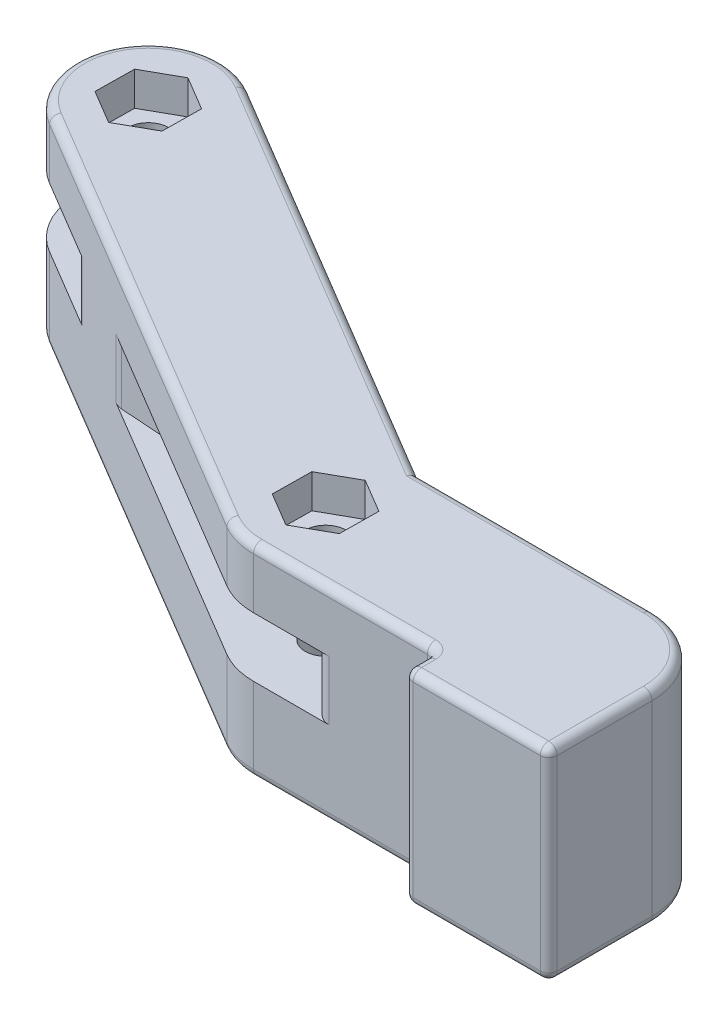
from build123d import *

# Parameters (mm, degrees)
SKETCH1_R               = 1.2
BOSS_EXTRUDE1_DEPTH     = 12
CUT_EXTRUDE1_DEPTH      = 2.5
CUT_EXTRUDE1_DEPTH_BACK = 1
CUT_EXTRUDE2_DEPTH      = 2
SKETCH5_R               = 2.05
CUT_EXTRUDE3_DEPTH      = 2
FILLET1_R               = 1
FILLET2_R               = 0.5


with BuildPart() as part:
    # Sketch1 → Boss-Extrude1 (new body)
    with BuildSketch(Plane(origin=(0, 0, 0), x_dir=(1, 0, 0), z_dir=(0, 1, 0))):
        with BuildLine():
            Line((1.323018794, 17.222814504), (26.105840038, 2.488576956))
            Line((26.105840038, 2.488576956), (39.937870576, 2.488576956))
            ThreePointArc((39.937870576, 2.488576956), (42.943074396, 1.243780776), (44.187870576, -1.761423044))
            Line((44.187870576, -1.761423044), (44.187870576, -7.85))
            Line((44.187870576, -7.85), (35.687870576, -7.85))
            Line((35.687870576, -7.85), (35.687870576, -6.011423044))
            Line((35.687870576, -6.011423044), (24.937870576, -6.011423044))
            ThreePointArc((24.937870576, -6.011423044), (23.811655258, -5.859488326), (22.76596286, -5.414547306))
            Line((22.76596286, -5.414547306), (-3.020796638, 9.91656598))
            ThreePointArc((-3.020796638, 9.91656598), (-4.502013184, 15.741597958), (1.323018794, 17.222814504))
        make_face()
        with Locations(Location((-0.848888922, 13.569690242, 0), (0, 0, 270))):
            Circle(SKETCH1_R, mode=Mode.SUBTRACT)
        with Locations(Location((24.937870576, -1.761423044, 0), (0, 0, 270))):
            Circle(SKETCH1_R, mode=Mode.SUBTRACT)
    extrude(amount=BOSS_EXTRUDE1_DEPTH)

    # Sketch3 → Cut-Extrude1 (cut, two sides: drawn at the far end of the back side and taken through both)
    with BuildSketch(Plane(origin=(0, 6, 0), x_dir=(1, 0, 0), z_dir=(0, 1, 0)).offset(-CUT_EXTRUDE1_DEPTH_BACK)):
        with BuildLine():
            Line((-22.892544244, 0.947199994), (-3.741433166, 17.016890236))
            ThreePointArc((-3.741433166, 17.016890236), (2.065644543, 16.998318931), (3.019125003, 11.270023249))
            Line((3.019125003, 11.270023249), (-1.084785494, 4.367292117))
            ThreePointArc((-1.084785494, 4.367292117), (-0.38864398, 4.483185905), (0.317056148, 4.488816704))
            Line((0.317056148, 4.488816704), (25.254926724, 2.72739366))
            ThreePointArc((25.254926724, 2.72739366), (28.925298394, 0.324342858), (28.805884501, -4.061090037))
            Line((28.805884501, -4.061090037), (16.029956762, -25.550056285))
            ThreePointArc((16.029956762, -25.550056285), (9.862275844, -27.118403217), (8.293928913, -20.950722299))
            Line((8.293928913, -20.950722299), (17.339631919, -5.735951945))
            Line((17.339631919, -5.735951945), (-0.317056148, -4.488816704))
            ThreePointArc((-0.317056148, -4.488816704), (-2.876129239, -3.460907482), (-4.354991754, -1.1331579))
            Line((-4.354991754, -1.1331579), (-9.756802736, -10.218942999))
            ThreePointArc((-9.756802736, -10.218942999), (-15.508332614, -12.006129032), (-17.885892009, -6.472473713))
            ThreePointArc((-17.885892009, -6.472473713), (-23.730198417, -5.017065706), (-22.892544244, 0.947199994))
        make_face()
    extrude(amount=CUT_EXTRUDE1_DEPTH + CUT_EXTRUDE1_DEPTH_BACK, mode=Mode.SUBTRACT)

    # Sketch4 → Cut-Extrude2 (cut)
    with BuildSketch(Plane(origin=(0, 12, 0), x_dir=(1, 0, 0), z_dir=(0, 1, 0))):
        Polygon((22.952804904, -0.581233393), (22.923263521, -2.890445518), (24.908329193, -4.07063517), (26.922936248, -2.941612695), (26.952477631, -0.63240057), (24.967411959, 0.547789081), align=None)
        Polygon((1.13617675, 12.389500591), (1.165718133, 14.698712717), (-0.819347539, 15.878902368), (-2.833954594, 14.749879893), (-2.863495977, 12.440667768), (-0.878430305, 11.260478117), align=None)
    extrude(amount=-CUT_EXTRUDE2_DEPTH, mode=Mode.SUBTRACT)

    # Sketch5 → Cut-Extrude3 (cut)
    with BuildSketch(Plane.XZ):
        with Locations(Location((-0.848888922, -13.569690242, 0), (0, 0, 270))):
            Circle(SKETCH5_R)
        with Locations(Location((24.937870576, 1.761423044, 0), (0, 0, 270))):
            Circle(SKETCH5_R)
    extrude(amount=-CUT_EXTRUDE3_DEPTH, mode=Mode.SUBTRACT)

    # Fillet1
    # the kernel refuses this fillet: 1 mm, written as the material it takes off along each edge
    with BuildSketch(Plane(origin=(26.416890522, 8.5, -2.488576956), x_dir=(1, 0, 0), z_dir=(0, -1, 0)), Plane(origin=(2.594323181, 8.5, -16.466980426), x_dir=(0.8595586499303869, 0, 0.511037109542791), z_dir=(0, -1, 0))) as fillet1_piece_1:
        with BuildLine():
            CenterArc((2.958039892, 1), FILLET1_R, 143.77845338, 126.22154662)
            ThreePointArc((2.151301739, 1.590909091), (1.196627809, 0.631863865), (0, 0))
            Line((0, 0), (2.958039892, 0))
        make_face()
    extrude(amount=3.5, mode=Mode.SUBTRACT)
    with BuildSketch(Plane(origin=(27.64634461, 5, 6.011423044), x_dir=(1, 0, 0), z_dir=(0, 1, 0))) as fillet1_piece_2:
        with BuildLine():
            CenterArc((FILLET1_R * 1.75792205647, FILLET1_R), FILLET1_R, 149.267064192, 120.732935808)
            Line((FILLET1_R * 0.89836340654, FILLET1_R * 1.51103710954), (0, 0))
            Line((0, 0), (FILLET1_R * 1.75792205647, 0))
        make_face()
    extrude(amount=3.5, mode=Mode.SUBTRACT)
    with BuildSketch(Plane(origin=(6.889434617, 8.5, -4.024593471), x_dir=(-0.8595586499303914, 0, -0.5110371095427833), z_dir=(0, -1, 0))) as fillet1_piece_3:
        with BuildLine():
            CenterArc((FILLET1_R * 0.237244349344, FILLET1_R), FILLET1_R, 243.307295898, 26.692704102)
            Line((-FILLET1_R * 0.211960885996, FILLET1_R * 0.10657140378), (0, 0))
            Line((0, 0), (FILLET1_R * 0.237244349344, 0))
        make_face()
    extrude(amount=3.5, mode=Mode.SUBTRACT)
    with BuildSketch(Plane(origin=(0.847217287, 5, -7.616898987), x_dir=(0.8595586499303871, 0, 0.5110371095427908), z_dir=(0, 1, 0))) as fillet1_piece_4:
        with BuildLine():
            CenterArc((FILLET1_R, FILLET1_R), FILLET1_R, 180, 90)
            Line((0, FILLET1_R), (0, 0))
            Line((0, 0), (FILLET1_R, 0))
        make_face()
    extrude(amount=3.5, mode=Mode.SUBTRACT)
    with BuildSketch(Plane(origin=(25.838473904, 8.5, -2.647535296), x_dir=(-0.8595586499303872, 0, -0.5110371095427904), z_dir=(0, -1, 0))) as fillet1_piece_5:
        with BuildLine():
            CenterArc((4.300870532, -1), FILLET1_R, 90, 153.307295898)
            Line((3.851665297, -1.893428596), (3.806744773, -1.982771456))
            ThreePointArc((3.806744773, -1.982771456), (0.49748309, -0.318914177), (-0.03286711, -0.094444444))
            Line((-0.03286711, -0.094444444), (0, 0.1))
            Line((0, 0.1), (4.300870532, 0.1))
            Line((4.300870532, 0.1), (4.300870532, 0))
        make_face()
    extrude(amount=3.5, mode=Mode.SUBTRACT)
    with BuildSketch(Plane(origin=(24.937870576, 0, 1.761423044), x_dir=(0, 0, -1), z_dir=(-1, 0, 0))) as fillet1_piece_6:
        with BuildLine():
            CenterArc((2.05 + FILLET1_R, -FILLET1_R), FILLET1_R, 90, 90)
            Line((2.05, -FILLET1_R), (2.05, 0))
            Line((2.05, 0), (2.05 + FILLET1_R, 0))
        make_face()
    revolve(axis=Axis((24.937870576, 0, 1.761423044), (0, -1, 0)), mode=Mode.SUBTRACT)
    with BuildSketch(Plane(origin=(-0.848888922, 0, -13.569690242), x_dir=(0, 0, -1), z_dir=(-1, 0, 0))) as fillet1_piece_7:
        with BuildLine():
            CenterArc((2.05 + FILLET1_R, -FILLET1_R), FILLET1_R, 90, 90)
            Line((2.05, -FILLET1_R), (2.05, 0))
            Line((2.05, 0), (2.05 + FILLET1_R, 0))
        make_face()
    revolve(axis=Axis((-0.848888922, 0, -13.569690242), (0, -1, 0)), mode=Mode.SUBTRACT)

    # Fillet2
    fillet2_edges = [part.edges().sort_by_distance(p)[0] for p in [
        (-4.502013184, 0, -15.741597958),
        (13.714429416, 0, -9.85569573),
        (33.021855307, 0, -2.488576956),
        (42.943074396, 0, -1.243780776),
        (44.187870576, 0, 4.805711522),
        (39.937870576, 0, 7.85),
        (35.687870576, 0, 6.930711522),
        (30.312870576, 0, 6.011423044),
        (9.872583111, 12, -2.251009337),
        (23.811655258, 0, 5.859488326),
        (9.872583111, 0, -2.251009337),
        (23.811655258, 12, 5.859488326),
        (44.187870576, 6, 7.85),
        (35.687870576, 6, 7.85),
        (35.687870576, 6, 6.011423044),
        (30.312870576, 12, 6.011423044),
        (35.687870576, 12, 6.930711522),
        (39.937870576, 12, 7.85),
        (44.187870576, 12, 4.805711522),
        (42.943074396, 12, -1.243780776),
        (33.021855307, 12, -2.488576956),
        (13.714429416, 12, -9.85569573),
        (-4.502013184, 12, -15.741597958),
    ]]
    fillet(fillet2_edges, radius=FILLET2_R)


solid = part.part
